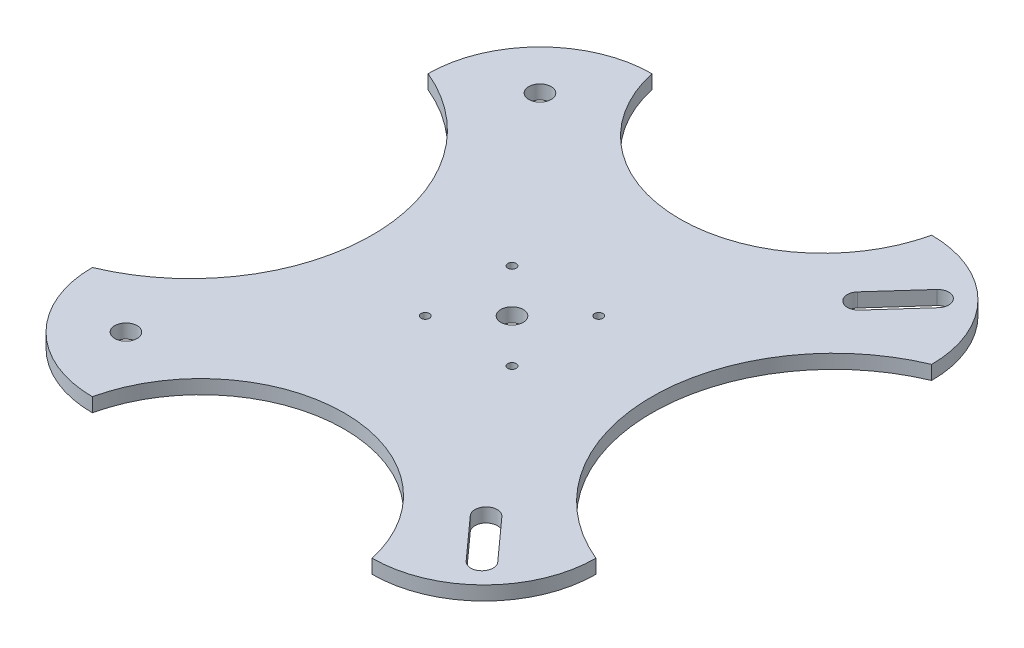
from build123d import *

# Parameters (mm, degrees)
SCHIZZO1_R                   = 4
ESTRUSIONE_ESTRUSIONE1_DEPTH = 5
SCHIZZO2_R                   = 1.5
TAGLIO_ESTRUSIONE1_DEPTH     = 135.629120178


with BuildPart() as part:
    # Schizzo1 → Estrusione-Estrusione1 (new body)
    with BuildSketch(Plane(origin=(0, 0, 0), x_dir=(1, 0, 0), z_dir=(0, 1, 0))):
        with BuildLine():
            ThreePointArc((-50, 100), (-78.284271247, 88.284271247), (-90, 60))
            ThreePointArc((-90, 60), (-50, 0), (-90, -60))
            ThreePointArc((-90, -60), (-78.284271247, -88.284271247), (-50, -100))
            ThreePointArc((-50, -100), (0, -60), (50, -100))
            ThreePointArc((50, -100), (78.284271247, -88.284271247), (90, -60))
            ThreePointArc((90, -60), (50, 0), (90, 60))
            ThreePointArc((90, 60), (78.284271247, 88.284271247), (50, 100))
            ThreePointArc((50, 100), (0, 60), (-50, 100))
        make_face()
        with Locations((-64, 74)):
            Circle(SCHIZZO1_R, mode=Mode.SUBTRACT)
        with Locations((-64, -74)):
            Circle(SCHIZZO1_R, mode=Mode.SUBTRACT)
        Circle(SCHIZZO1_R, mode=Mode.SUBTRACT)
        with BuildLine():
            Line((73.662823901, -78.757082536), (60.283529269, -63.891199611))
            ThreePointArc((60.283529269, -63.891199611), (54.634493757, -63.593881953), (54.337176099, -69.242917464))
            Line((54.337176099, -69.242917464), (67.716470731, -84.108800389))
            ThreePointArc((67.716470731, -84.108800389), (73.365506243, -84.406118047), (73.662823901, -78.757082536))
        make_face(mode=Mode.SUBTRACT)
        with BuildLine():
            Line((60.283529269, 63.891199611), (73.662823901, 78.757082536))
            ThreePointArc((73.662823901, 78.757082536), (73.365506243, 84.406118047), (67.716470731, 84.108800389))
            Line((67.716470731, 84.108800389), (54.337176099, 69.242917464))
            ThreePointArc((54.337176099, 69.242917464), (54.634493757, 63.593881953), (60.283529269, 63.891199611))
        make_face(mode=Mode.SUBTRACT)
    extrude(amount=ESTRUSIONE_ESTRUSIONE1_DEPTH)

    # Schizzo2 → Taglio-Estrusione1 (cut, through all)
    with BuildSketch(Plane(origin=(0, 5, 0), x_dir=(1, 0, 0), z_dir=(0, 1, 0))):
        with Locations((-15.5, 15.5)):
            Circle(SCHIZZO2_R)
        with Locations((15.5, 15.5)):
            Circle(SCHIZZO2_R)
        with Locations((15.5, -15.5)):
            Circle(SCHIZZO2_R)
        with Locations((-15.5, -15.5)):
            Circle(SCHIZZO2_R)
    extrude(amount=-TAGLIO_ESTRUSIONE1_DEPTH, mode=Mode.SUBTRACT)


solid = part.part
